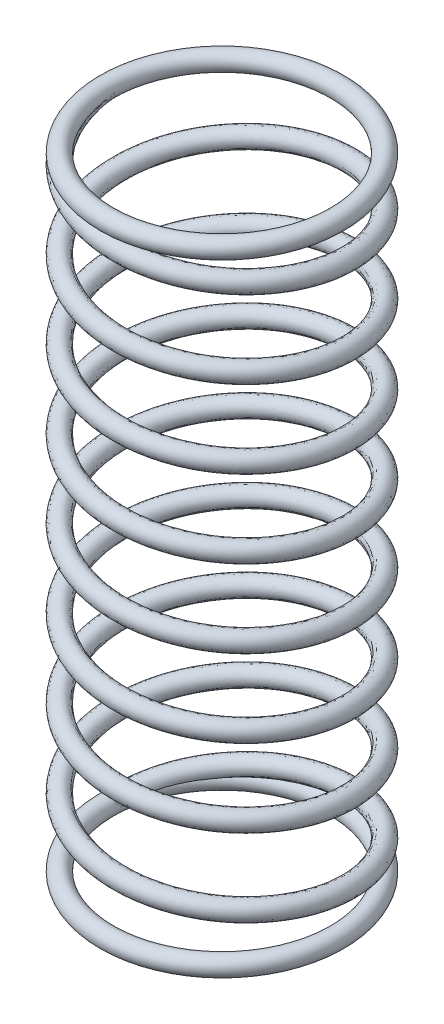
from build123d import *

# Parameters (mm, degrees)
BALAYAGE4_PROFILE_R   = 0.3
BALAYAGE5_PITCH       = 2.5
BALAYAGE5_HEIGHT      = 20
BALAYAGE5_RADIUS      = 3.7
BALAYAGE5_START_ANGLE = -90
BALAYAGE5_PROFILE_R   = 0.3
BALAYAGE8_PROFILE_R   = 0.3


with BuildPart() as part:
    # Balayage4: sweep along a path in Esquisse16
    with BuildLine(Plane(origin=(0, 0, 0), x_dir=(1, 0, 0), z_dir=(0, 1, 0))) as balayage4_path:
        CenterArc((0, 0), 3.7, 0, 360)
    # Balayage4 profile (on start of the path) → Balayage4 (sweep)
    with BuildSketch(Plane(origin=(3.7, 0, 0), x_dir=(-1, 0, 0), z_dir=(0, 0, -1))):
        Circle(BALAYAGE4_PROFILE_R)
    sweep(path=balayage4_path.line)


with BuildPart() as body_2:
    # Balayage5: sweep along a helix
    with BuildLine() as balayage5_path:
        add(Helix(BALAYAGE5_PITCH, BALAYAGE5_HEIGHT, BALAYAGE5_RADIUS, center=(0, 0, 0), direction=(0, 1, 0), lefthand=True, mode=Mode.PRIVATE).rotate(Axis((0, 0, 0), (0, 1, 0)), BALAYAGE5_START_ANGLE))
    # Balayage5 profile (on start of the path) → Balayage5 (sweep)
    with BuildSketch(Plane(origin=(-3.7, 0, 0), x_dir=(0, -0.9942675543765651, -0.10692067299659201), z_dir=(-3.7560668419545986e-13, 0.10692067299659201, -0.9942675543765651))):
        Circle(BALAYAGE5_PROFILE_R)
    sweep(path=balayage5_path.line, is_frenet=True)


with BuildPart() as body_3:
    # Balayage8: sweep along a path in Esquisse68
    with BuildLine(Plane(origin=(0, 20, 0), x_dir=(1, 0, 0), z_dir=(0, 1, 0))) as balayage8_path:
        CenterArc((0, 0), 3.7, 0, 360)
    # Balayage8 profile (on start of the path) → Balayage8 (sweep)
    with BuildSketch(Plane(origin=(3.7, 20, 0), x_dir=(-1, 0, 0), z_dir=(0, 0, -1))):
        Circle(BALAYAGE8_PROFILE_R)
    sweep(path=balayage8_path.line)


solid = Compound([part.part, body_2.part, body_3.part])
